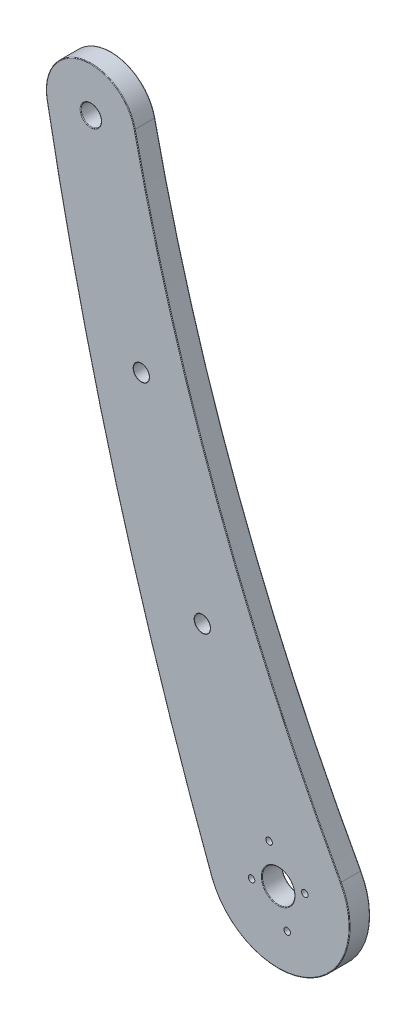
from build123d import *

# Parameters (mm, degrees)
SKETCH1_R                        = 2.5
SKETCH1_R_2                      = 4
BOSS_EXTRUDE1_DEPTH              = 5
M3_5_CLEARANCE_HOLE1_D           = 3.9
M3_5_CLEARANCE_HOLE1_DEPTH       = 10
M3_5_CLEARANCE_HOLE1_CSINK_D     = 3.95
M3_5_CLEARANCE_HOLE1_CSINK_ANGLE = 90
M3_5_CLEARANCE_HOLE1_TIP         = 1.171678207
FILLET1_R                        = 0.15
SKETCH6_R                        = 0.8
CUT_EXTRUDE1_DEPTH               = 224.096656241


with BuildPart() as part:
    # Sketch1 → Boss-Extrude1 (new body)
    with BuildSketch(Plane.XY):
        with BuildLine():
            ThreePointArc((-55.398880578, 200.617901185), (-35.007116858, 131.494128363), (-4.889745153, 66.019981417))
            ThreePointArc((-4.889745153, 66.019981417), (-12.896171763, 41.686242107), (-36.596127074, 51.409711349))
            ThreePointArc((-36.596127074, 51.409711349), (-59.988982978, 122.945483177), (-76.962191703, 196.270121219))
            ThreePointArc((-76.962191703, 196.270121219), (-68.320402221, 209.056921333), (-55.398880578, 200.617901185))
        make_face()
        with Locations((-66.146241747, 198.273924243)):
            Circle(SKETCH1_R, mode=Mode.SUBTRACT)
        with Locations((-20.22, 57.58)):
            Circle(SKETCH1_R_2, mode=Mode.SUBTRACT)
    extrude(amount=-BOSS_EXTRUDE1_DEPTH)

    # M3.5 Clearance Hole1
    with Locations(Plane.XY):
        with Locations((-53.774409594, 149.828720465), (-38.812894637, 103.994483397)):
            CounterSinkHole(M3_5_CLEARANCE_HOLE1_D / 2, M3_5_CLEARANCE_HOLE1_CSINK_D / 2, depth=M3_5_CLEARANCE_HOLE1_DEPTH, counter_sink_angle=M3_5_CLEARANCE_HOLE1_CSINK_ANGLE)
            with Locations((0, 0, -(M3_5_CLEARANCE_HOLE1_DEPTH + M3_5_CLEARANCE_HOLE1_TIP / 2))):  # 118° drill point
                Cone(0, M3_5_CLEARANCE_HOLE1_D / 2, M3_5_CLEARANCE_HOLE1_TIP, mode=Mode.SUBTRACT)

    # Fillet1
    # the kernel refuses this fillet: 0.15 mm, written as the material it takes off along each edge
    with BuildSketch(Plane(origin=(-66.146241747, 198.273924243, -5), x_dir=(1, 0, 0), z_dir=(0, -1, 0))) as fillet1_piece_1:
        with BuildLine():
            CenterArc((2.5 + FILLET1_R, FILLET1_R), FILLET1_R, 180, 90)
            Line((2.5, FILLET1_R), (2.5 - FILLET1_R * 0.02, FILLET1_R))
            Line((2.5 - FILLET1_R * 0.02, FILLET1_R), (2.5 - FILLET1_R * 0.02, -FILLET1_R * 0.02))
            Line((2.5 - FILLET1_R * 0.02, -FILLET1_R * 0.02), (2.5 + FILLET1_R, -FILLET1_R * 0.02))
            Line((2.5 + FILLET1_R, -FILLET1_R * 0.02), (2.5 + FILLET1_R, 0))
        make_face()
    revolve(axis=Axis((-66.146241747, 198.273924243, -5), (0, 0, 1)), mode=Mode.SUBTRACT)
    with BuildSketch(Plane(origin=(-66.146241747, 198.273924243, 0), x_dir=(1, 0, 0), z_dir=(0, -1, 0))) as fillet1_piece_2:
        with BuildLine():
            CenterArc((2.5 + FILLET1_R, -FILLET1_R), FILLET1_R, 90, 90)
            Line((2.5 + FILLET1_R, 0), (2.5 + FILLET1_R, FILLET1_R * 0.02))
            Line((2.5 + FILLET1_R, FILLET1_R * 0.02), (2.5 - FILLET1_R * 0.02, FILLET1_R * 0.02))
            Line((2.5 - FILLET1_R * 0.02, FILLET1_R * 0.02), (2.5 - FILLET1_R * 0.02, -FILLET1_R))
            Line((2.5 - FILLET1_R * 0.02, -FILLET1_R), (2.5, -FILLET1_R))
        make_face()
    revolve(axis=Axis((-66.146241747, 198.273924243, 0), (0, 0, 1)), mode=Mode.SUBTRACT)
    with BuildSketch(Plane(origin=(-20.22, 57.58, -5), x_dir=(0.8760145626973271, 0.4822846524016815, 0), z_dir=(-0.4822846524016815, 0.8760145626973271, 0))) as fillet1_piece_3:
        with BuildLine():
            CenterArc((17.5 - FILLET1_R, -FILLET1_R), FILLET1_R, 0, 90)
            Line((17.5, -FILLET1_R), (17.5 + FILLET1_R * 0.02, -FILLET1_R))
            Line((17.5 + FILLET1_R * 0.02, -FILLET1_R), (17.5 + FILLET1_R * 0.02, FILLET1_R * 0.02))
            Line((17.5 + FILLET1_R * 0.02, FILLET1_R * 0.02), (17.5 - FILLET1_R, FILLET1_R * 0.02))
            Line((17.5 - FILLET1_R, FILLET1_R * 0.02), (17.5 - FILLET1_R, 0))
        make_face()
    revolve(axis=Axis((-20.22, 57.58, -5), (0, 0, -1)), revolution_arc=188.189036898, mode=Mode.SUBTRACT)
    with BuildSketch(Plane(origin=(-20.22, 57.58, -5), x_dir=(1, 0, 0), z_dir=(0, -1, 0))) as fillet1_piece_4:
        with BuildLine():
            CenterArc((4 + FILLET1_R, FILLET1_R), FILLET1_R, 180, 90)
            Line((4, FILLET1_R), (4 - FILLET1_R * 0.02, FILLET1_R))
            Line((4 - FILLET1_R * 0.02, FILLET1_R), (4 - FILLET1_R * 0.02, -FILLET1_R * 0.02))
            Line((4 - FILLET1_R * 0.02, -FILLET1_R * 0.02), (4 + FILLET1_R, -FILLET1_R * 0.02))
            Line((4 + FILLET1_R, -FILLET1_R * 0.02), (4 + FILLET1_R, 0))
        make_face()
    revolve(axis=Axis((-20.22, 57.58, -5), (0, 0, 1)), mode=Mode.SUBTRACT)
    with BuildSketch(Plane(origin=(-20.22, 57.58, 0), x_dir=(1, 0, 0), z_dir=(0, -1, 0))) as fillet1_piece_5:
        with BuildLine():
            CenterArc((4 + FILLET1_R, -FILLET1_R), FILLET1_R, 90, 90)
            Line((4 + FILLET1_R, 0), (4 + FILLET1_R, FILLET1_R * 0.02))
            Line((4 + FILLET1_R, FILLET1_R * 0.02), (4 - FILLET1_R * 0.02, FILLET1_R * 0.02))
            Line((4 - FILLET1_R * 0.02, FILLET1_R * 0.02), (4 - FILLET1_R * 0.02, -FILLET1_R))
            Line((4 - FILLET1_R * 0.02, -FILLET1_R), (4, -FILLET1_R))
        make_face()
    revolve(axis=Axis((-20.22, 57.58, 0), (0, 0, 1)), mode=Mode.SUBTRACT)
    with BuildSketch(Plane(origin=(433.117536196, 307.162307618, -5), x_dir=(-0.9770328335482352, -0.21308881286615342, 0), z_dir=(-0.21308881286615342, 0.9770328335482352, 0))) as fillet1_piece_6:
        with BuildLine():
            CenterArc((500 + FILLET1_R, FILLET1_R), FILLET1_R, 180, 90)
            Line((500, FILLET1_R), (500 - FILLET1_R * 0.0200000000003, FILLET1_R))
            Line((500 - FILLET1_R * 0.0200000000003, FILLET1_R), (500 - FILLET1_R * 0.0200000000003, -FILLET1_R * 0.02))
            Line((500 - FILLET1_R * 0.0200000000003, -FILLET1_R * 0.02), (500 + FILLET1_R, -FILLET1_R * 0.02))
            Line((500 + FILLET1_R, -FILLET1_R * 0.02), (500 + FILLET1_R, 0))
        make_face()
    revolve(axis=Axis((433.117536196, 307.162307618, -5), (0, 0, 1)), revolution_arc=16.531296607, mode=Mode.SUBTRACT)
    with BuildSketch(Plane(origin=(-38.812894637, 103.994483397, -5), x_dir=(-1, 0, 0), z_dir=(0, -1, 0))) as fillet1_piece_7:
        with BuildLine():
            CenterArc((1.95 + FILLET1_R, -FILLET1_R), FILLET1_R, 90, 90)
            Line((1.95, -FILLET1_R), (1.95 - FILLET1_R * 0.02, -FILLET1_R))
            Line((1.95 - FILLET1_R * 0.02, -FILLET1_R), (1.95 - FILLET1_R * 0.02, FILLET1_R * 0.02))
            Line((1.95 - FILLET1_R * 0.02, FILLET1_R * 0.02), (1.95 + FILLET1_R, FILLET1_R * 0.02))
            Line((1.95 + FILLET1_R, FILLET1_R * 0.02), (1.95 + FILLET1_R, 0))
        make_face()
    revolve(axis=Axis((-38.812894637, 103.994483397, -5), (0, 0, -1)), mode=Mode.SUBTRACT)
    with BuildSketch(Plane(origin=(-38.812894637, 103.994483397, 0), x_dir=(-1, 0, 0), z_dir=(0, -1, 0))) as fillet1_piece_8:
        with BuildLine():
            CenterArc((2.03291562, 0.15), FILLET1_R, 236.442690238, 33.557309762)
            Line((2.03291562, 0), (2.03291562, -0.003))
            Line((2.03291562, -0.003), (1.975, -0.003))
            Line((1.975, -0.003), (1.97287868, -0.00212132))
            ThreePointArc((1.97287868, -0.00212132), (1.96037868, 0.01037868), (1.948341688, 0.0225))
            Line((1.948341688, 0.0225), (1.95, 0.025))
        make_face()
    revolve(axis=Axis((-38.812894637, 103.994483397, 0), (0, 0, -1)), mode=Mode.SUBTRACT)
    with BuildSketch(Plane(origin=(-53.774409594, 149.828720465, -5), x_dir=(-1, 0, 0), z_dir=(0, -1, 0))) as fillet1_piece_9:
        with BuildLine():
            CenterArc((1.95 + FILLET1_R, -FILLET1_R), FILLET1_R, 90, 90)
            Line((1.95, -FILLET1_R), (1.95 - FILLET1_R * 0.02, -FILLET1_R))
            Line((1.95 - FILLET1_R * 0.02, -FILLET1_R), (1.95 - FILLET1_R * 0.02, FILLET1_R * 0.02))
            Line((1.95 - FILLET1_R * 0.02, FILLET1_R * 0.02), (1.95 + FILLET1_R, FILLET1_R * 0.02))
            Line((1.95 + FILLET1_R, FILLET1_R * 0.02), (1.95 + FILLET1_R, 0))
        make_face()
    revolve(axis=Axis((-53.774409594, 149.828720465, -5), (0, 0, -1)), mode=Mode.SUBTRACT)
    with BuildSketch(Plane(origin=(-53.774409594, 149.828720465, 0), x_dir=(-1, 0, 0), z_dir=(0, -1, 0))) as fillet1_piece_10:
        with BuildLine():
            CenterArc((2.03291562, 0.15), FILLET1_R, 236.442690238, 33.557309762)
            Line((2.03291562, 0), (2.03291562, -0.003))
            Line((2.03291562, -0.003), (1.975, -0.003))
            Line((1.975, -0.003), (1.97287868, -0.00212132))
            ThreePointArc((1.97287868, -0.00212132), (1.96037868, 0.01037868), (1.948341688, 0.0225))
            Line((1.948341688, 0.0225), (1.95, 0.025))
        make_face()
    revolve(axis=Axis((-53.774409594, 149.828720465, 0), (0, 0, -1)), mode=Mode.SUBTRACT)
    with BuildSketch(Plane(origin=(-66.146241747, 198.273924243, -5), x_dir=(-0.9832681777691128, -0.18216391131782472, 0), z_dir=(0.18216391131782472, -0.9832681777691128, 0))) as fillet1_piece_11:
        with BuildLine():
            CenterArc((11 - FILLET1_R, -FILLET1_R), FILLET1_R, 0, 90)
            Line((11 - FILLET1_R, 0), (11 - FILLET1_R, FILLET1_R * 0.02))
            Line((11 - FILLET1_R, FILLET1_R * 0.02), (11 + FILLET1_R * 0.02, FILLET1_R * 0.02))
            Line((11 + FILLET1_R * 0.02, FILLET1_R * 0.02), (11 + FILLET1_R * 0.02, -FILLET1_R))
            Line((11 + FILLET1_R * 0.02, -FILLET1_R), (11, -FILLET1_R))
        make_face()
    revolve(axis=Axis((-66.146241747, 198.273924243, -5), (0, 0, -1)), revolution_arc=178.192400693, mode=Mode.SUBTRACT)
    with BuildSketch(Plane(origin=(433.117536196, 307.162307618, 0), x_dir=(-0.9770328335482352, -0.21308881286615342, 0), z_dir=(-0.21308881286615342, 0.9770328335482352, 0))) as fillet1_piece_12:
        with BuildLine():
            CenterArc((500 + FILLET1_R, -FILLET1_R), FILLET1_R, 90, 90)
            Line((500, -FILLET1_R), (500 - FILLET1_R * 0.0200000000003, -FILLET1_R))
            Line((500 - FILLET1_R * 0.0200000000003, -FILLET1_R), (500 - FILLET1_R * 0.0200000000003, FILLET1_R * 0.02))
            Line((500 - FILLET1_R * 0.0200000000003, FILLET1_R * 0.02), (500 + FILLET1_R, FILLET1_R * 0.02))
            Line((500 + FILLET1_R, FILLET1_R * 0.02), (500 + FILLET1_R, 0))
        make_face()
    revolve(axis=Axis((433.117536196, 307.162307618, 0), (0, 0, 1)), revolution_arc=16.531296607, mode=Mode.SUBTRACT)
    with BuildSketch(Plane(origin=(-20.22, 57.58, 0), x_dir=(0.8760145626973271, 0.4822846524016815, 0), z_dir=(-0.4822846524016815, 0.8760145626973271, 0))) as fillet1_piece_13:
        with BuildLine():
            CenterArc((17.5 - FILLET1_R, FILLET1_R), FILLET1_R, 270, 90)
            Line((17.5 - FILLET1_R, 0), (17.5 - FILLET1_R, -FILLET1_R * 0.02))
            Line((17.5 - FILLET1_R, -FILLET1_R * 0.02), (17.5 + FILLET1_R * 0.02, -FILLET1_R * 0.02))
            Line((17.5 + FILLET1_R * 0.02, -FILLET1_R * 0.02), (17.5 + FILLET1_R * 0.02, FILLET1_R))
            Line((17.5 + FILLET1_R * 0.02, FILLET1_R), (17.5, FILLET1_R))
        make_face()
    revolve(axis=Axis((-20.22, 57.58, 0), (0, 0, -1)), revolution_arc=188.189036898, mode=Mode.SUBTRACT)
    with BuildSketch(Plane(origin=(758.815759401, 351.109445839, 0), x_dir=(-0.9357786899711781, -0.3525879229296231, 0), z_dir=(0.3525879229296231, -0.9357786899711781, 0))) as fillet1_piece_14:
        with BuildLine():
            CenterArc((850 - FILLET1_R, FILLET1_R), FILLET1_R, 270, 90)
            Line((850, FILLET1_R), (850 + FILLET1_R * 0.020000000001, FILLET1_R))
            Line((850 + FILLET1_R * 0.020000000001, FILLET1_R), (850 + FILLET1_R * 0.020000000001, -FILLET1_R * 0.02))
            Line((850 + FILLET1_R * 0.020000000001, -FILLET1_R * 0.02), (850 - FILLET1_R, -FILLET1_R * 0.02))
            Line((850 - FILLET1_R, -FILLET1_R * 0.02), (850 - FILLET1_R, 0))
        make_face()
    revolve(axis=Axis((758.815759401, 351.109445839, 0), (0, 0, -1)), revolution_arc=10.149859016, mode=Mode.SUBTRACT)
    with BuildSketch(Plane(origin=(-66.146241747, 198.273924243, 0), x_dir=(-0.9832681777691128, -0.18216391131782472, 0), z_dir=(0.18216391131782472, -0.9832681777691128, 0))) as fillet1_piece_15:
        with BuildLine():
            CenterArc((11 - FILLET1_R, FILLET1_R), FILLET1_R, 270, 90)
            Line((11 - FILLET1_R, 0), (11 - FILLET1_R, -FILLET1_R * 0.02))
            Line((11 - FILLET1_R, -FILLET1_R * 0.02), (11 + FILLET1_R * 0.02, -FILLET1_R * 0.02))
            Line((11 + FILLET1_R * 0.02, -FILLET1_R * 0.02), (11 + FILLET1_R * 0.02, FILLET1_R))
            Line((11 + FILLET1_R * 0.02, FILLET1_R), (11, FILLET1_R))
        make_face()
    revolve(axis=Axis((-66.146241747, 198.273924243, 0), (0, 0, -1)), revolution_arc=178.192400693, mode=Mode.SUBTRACT)
    with BuildSketch(Plane(origin=(758.815759401, 351.109445839, -5), x_dir=(-0.9357786899711781, -0.3525879229296231, 0), z_dir=(0.3525879229296231, -0.9357786899711781, 0))) as fillet1_piece_16:
        with BuildLine():
            CenterArc((850 - FILLET1_R, -FILLET1_R), FILLET1_R, 0, 90)
            Line((850, -FILLET1_R), (850 + FILLET1_R * 0.020000000001, -FILLET1_R))
            Line((850 + FILLET1_R * 0.020000000001, -FILLET1_R), (850 + FILLET1_R * 0.020000000001, FILLET1_R * 0.02))
            Line((850 + FILLET1_R * 0.020000000001, FILLET1_R * 0.02), (850 - FILLET1_R, FILLET1_R * 0.02))
            Line((850 - FILLET1_R, FILLET1_R * 0.02), (850 - FILLET1_R, 0))
        make_face()
    revolve(axis=Axis((758.815759401, 351.109445839, -5), (0, 0, -1)), revolution_arc=10.149859016, mode=Mode.SUBTRACT)

    # Sketch6 → Cut-Extrude1 (cut, through all)
    with BuildSketch(Plane.XY):
        with Locations((-17.999947241, 49.116320791)):
            Circle(SKETCH6_R)
        with Locations((-13.690876039, 59.292612128)):
            Circle(SKETCH6_R)
        with Locations((-22.440052759, 66.043679209)):
            Circle(SKETCH6_R)
        with Locations((-26.749123961, 55.867387872)):
            Circle(SKETCH6_R)
    extrude(amount=-CUT_EXTRUDE1_DEPTH, mode=Mode.SUBTRACT)


solid = part.part
